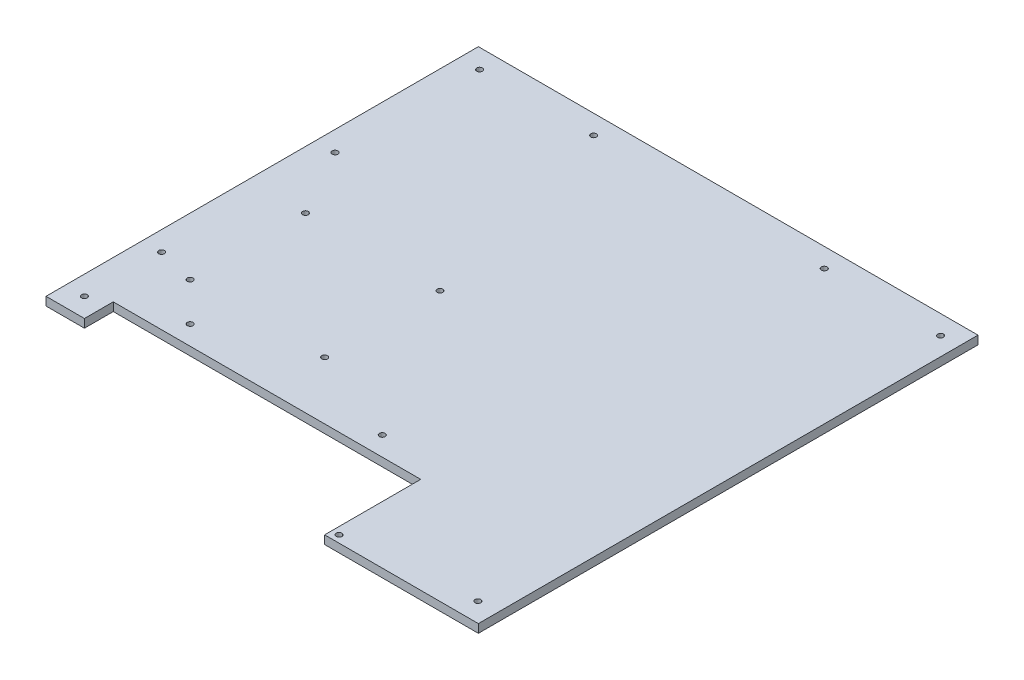
from build123d import *

# Parameters (mm, degrees)
BOSS_EXTRUDE1_DEPTH              = 5.588
F_6_CLEARANCE_HOLE1_D            = 3.7973
F_6_CLEARANCE_HOLE3_MOUNT_SIDE_D = 3.7973
F_6_CLEARANCE_HOLE2_D            = 3.7973


with BuildPart() as part:
    # Sketch1 → Boss-Extrude1 (new body)
    with BuildSketch(Plane(origin=(0, 0, 0), x_dir=(1, 0, 0), z_dir=(0, 1, 0))):
        Polygon((-165.1, -120.65), (-165.1, 165.1), (165.1, 165.1), (165.1, -165.1), (63.5, -165.1), (63.5, -101.6), (-139.7, -101.6), (-139.7, -120.65), align=None)
    extrude(amount=BOSS_EXTRUDE1_DEPTH)

    # #6 Clearance Hole1 (through all)
    with Locations(Plane(origin=(-76.2, 5.588, -152.4), x_dir=(0, 0, 1), z_dir=(0, 1, 0))):
        with Locations((0, 0), (0, 152.4), (0, -75.3745), (0, 229.2477), (304.8, 228.3079), (312.7375, 144.4625), (260.35, -76.2), (241.3, -25.4), (241.3, 101.6)):
            Hole(F_6_CLEARANCE_HOLE1_D / 2)

    # #6 Clearance Hole3 - Mount Side (through all)
    with Locations(Plane(origin=(-151.8539, 5.588, -57.149523043), x_dir=(0, 0, 1), z_dir=(0, 1, 0))):
        with Locations((0, 0), (114.299523043, -0.3302)):
            Hole(F_6_CLEARANCE_HOLE3_MOUNT_SIDE_D / 2)

    # #6 Clearance Hole2 (through all)
    with Locations(Plane(origin=(-127, 5.588, -12.7), x_dir=(0, 0, 1), z_dir=(0, 1, 0))):
        with Locations((0, 0), (0, 88.9), (76.2, 88.9), (76.2, 0)):
            Hole(F_6_CLEARANCE_HOLE2_D / 2)


solid = part.part
